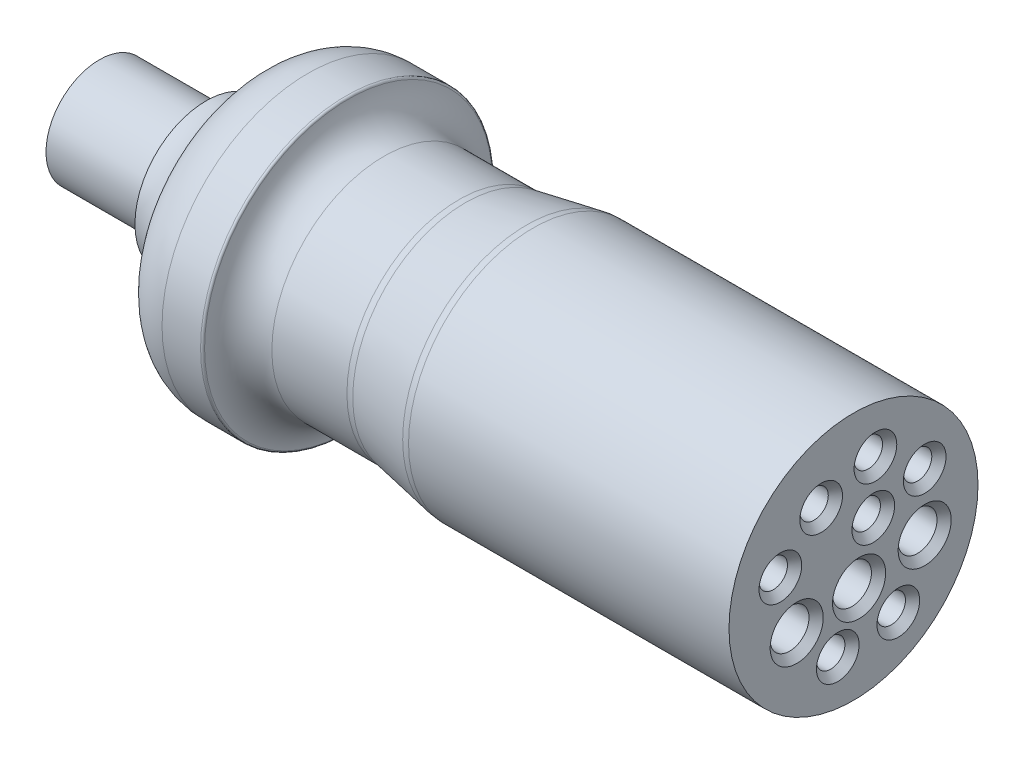
from build123d import *

# Parameters (mm, degrees)
FILLET1_R           = 5
FILLET2_R           = 0.3
FILLET3_R           = 5
SKETCH6_R           = 2.0006066698857174
SKETCH6_R_2         = 2.000606669885716
SKETCH6_R_3         = 2.733173099565215
SKETCH6_R_4         = 2.733173099565216
CUT_EXTRUDE1_DEPTH  = 21
CHAMFER1_SIZE       = 1
SKETCH7_R           = 7.5
SKETCH7_R_2         = 7
EXTRUDE_THIN1_DEPTH = 15


with BuildPart() as part:
    # Sketch3 → Revolve1 (revolve)
    with BuildSketch(Plane.XY, mode=Mode.PRIVATE) as revolve1_sk:
        with BuildLine():
            Line((45.5, 0), (45.5, 17.499999999999996))
            Line((45.5, 17.499999999999996), (0, 17.500000000006253))
            Line((0, 17.500000000006253), (-9.5, 15.75))
            Line((-9.5, 15.75), (-25.499999999999996, 15.749999999999996))
            Line((-25.499999999999996, 15.749999999999996), (-25.499999999999996, 20.5))
            Line((-25.499999999999996, 20.5), (-31.190911978745817, 20.5))
            ThreePointArc((-31.190911978745817, 20.5), (-35.92377580522551, 18.949806198638836), (-38.82242559008138, 14.9))
            ThreePointArc((-38.82242559008138, 14.9), (-41.358744151830265, 11.356419576191016), (-45.5, 10))
            Line((-45.5, 10), (-45.5, 0))
            Line((-45.5, 0), (45.5, 0))
        make_face()
    revolve(revolve1_sk.sketch.rotate(Axis((0, 0, 0), (1, 0, 0)), 90), axis=Axis((0, 0, 0), (1, 0, 0)))

    # Fillet1
    # the kernel refuses this fillet: 5 mm, written as the material it adds along each edge
    with BuildSketch(Plane(origin=(-25.499999999999996, 0, 0), x_dir=(0, 1.1e-16, 1), z_dir=(0, 1, -1.1e-16))) as fillet1_piece_1:
        with BuildLine():
            CenterArc((20.75, 4.993746088859542), FILLET1_R, 180, 87.13401601740111)
            Line((20.5, -3.55e-15), (20.495, -0.09987492177719304))
            ThreePointArc((20.495, -0.09987492177719304), (18.125, -0.10000000000000142), (15.749999999999996, -0.10000000000000142))
            Line((15.749999999999996, -0.10000000000000142), (15.649999999999997, 0))
            Line((15.649999999999997, 0), (15.65, 4.993746088859542))
            Line((15.65, 4.993746088859542), (15.75, 4.993746088859542))
        make_face()
    revolve(axis=Axis((-25.499999999999996, 0, 0), (1, 0, 0)))

    # Fillet2
    fillet2_edges = [part.edges().sort_by_distance(p)[0] for p in [
        (-25.499999999999996, -1.389e-14, -20.5),
    ]]
    fillet(fillet2_edges, radius=FILLET2_R)

    # Fillet3
    fillet3_edges = [part.edges().sort_by_distance(p)[0] for p in [
        (0, -4.09e-15, -17.500000000006253),
        (-9.5, -3.68e-15, -15.75),
    ]]
    fillet(fillet3_edges, radius=FILLET3_R)

    # Sketch6 → Cut-Extrude1 (cut)
    with BuildSketch(Plane(origin=(45.5, 0, 0), x_dir=(0, 0, -1), z_dir=(1, 0, 0))):
        with Locations((2.783799240820242, 3.3453538559838196)):
            Circle(SKETCH6_R)
        with Locations((3.0830749079385766, 10.64743253142253)):
            Circle(SKETCH6_R_2)
        with Locations((-4.545344467144663, 8.222212498881614)):
            Circle(SKETCH6_R)
        with Locations((-10.277682725877737, 2.6221589691962284)):
            Circle(SKETCH6_R_2)
        with Locations((10.005975728100823, 5.708802646975575)):
            Circle(SKETCH6_R_2)
        with Locations((-2.2083142539688767, -11.091357942080581)):
            Circle(SKETCH6_R)
        with Locations((6.30200331476561, -9.944890290333964)):
            Circle(SKETCH6_R_2)
        with Locations((10.005975728100823, -2.3605658249332846)):
            Circle(SKETCH6_R_3)
        with Locations((0.7901396044453501, -4.212552031600895)):
            Circle(SKETCH6_R_3)
        with Locations((-7.98474742238451, -5.270829863982385)):
            Circle(SKETCH6_R_4)
    extrude(amount=-CUT_EXTRUDE1_DEPTH, mode=Mode.SUBTRACT)

    # Chamfer1
    chamfer1_edges = [part.edges().sort_by_distance(p)[0] for p in [
        (45.5, 5.708802646975575, -8.005369058215107),
        (45.5, 2.622158969196229, 12.278289395763453),
        (45.5, 8.222212498881614, 6.5459511370303805),
        (45.5, 10.64743253142253, -1.0824682380528605),
        (45.5, -11.091357942080581, 4.208920923854594),
        (45.5, -9.944890290333964, -4.301396644879894),
        (45.5, -2.3605658249332855, -7.272802628535608),
        (45.5, -4.212552031600896, 1.943033495119865),
        (45.5, -5.270829863982385, 10.717920521949726),
        (45.5, 3.34535385598382, -0.7831925709345247),
    ]]
    chamfer(chamfer1_edges, length=CHAMFER1_SIZE)

    # Sketch7 → Extrude-Thin1 (add)
    with BuildSketch(Plane.ZY.offset(45.5)):
        Circle(SKETCH7_R)
        Circle(SKETCH7_R_2, mode=Mode.SUBTRACT)
    extrude(amount=EXTRUDE_THIN1_DEPTH)


solid = part.part
